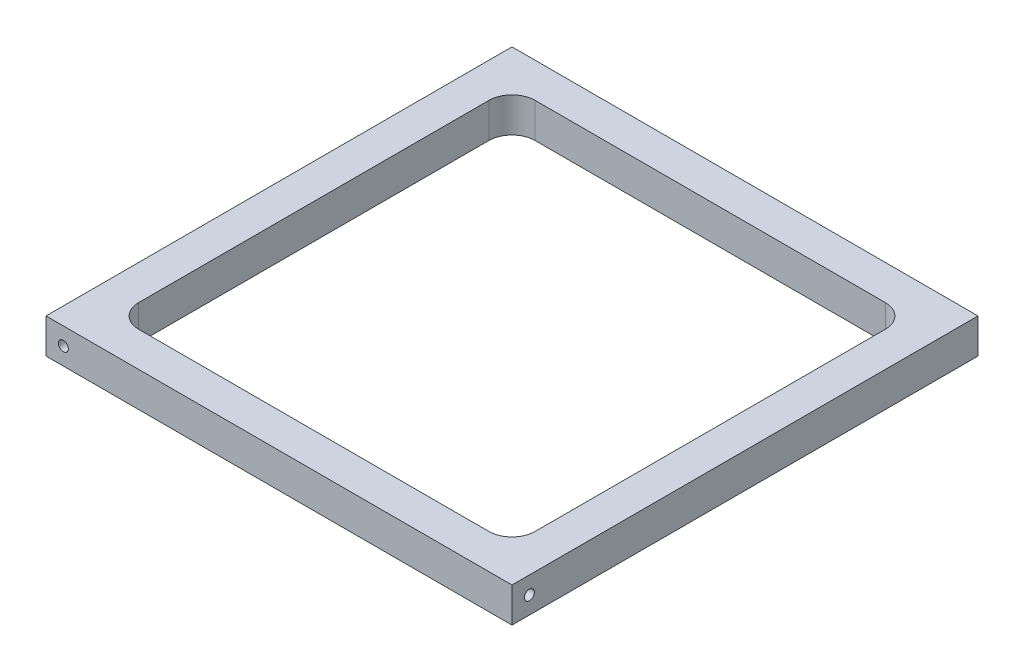
from build123d import *

# Parameters (mm, degrees)
SKETCH1_W           = 127.635
SKETCH1_H           = 127.635
BOSS_EXTRUDE1_DEPTH = 9.525
SKETCH5_W           = 108.585
SKETCH5_H           = 108.585
CUT_EXTRUDE1_DEPTH  = 9.525
FILLET1_R           = 6.35
SKETCH6_R           = 1.3589
TAPPED_HOLE_DEPTH   = 6.35
SKETCH7_R           = 1.35255
CUT_EXTRUDE3_DEPTH  = 6.35
SKETCH8_R           = 1.35255
CUT_EXTRUDE4_DEPTH  = 6.35
SKETCH9_R           = 1.35255
CUT_EXTRUDE5_DEPTH  = 6.35


with BuildPart() as part:
    # Sketch1 → Boss-Extrude1 (new body)
    with BuildSketch(Plane(origin=(0, 0, 0), x_dir=(1, 0, 0), z_dir=(0, 1, 0))):
        with Locations((63.8175, 63.8175)):
            Rectangle(SKETCH1_W, SKETCH1_H)
    extrude(amount=BOSS_EXTRUDE1_DEPTH)

    # Sketch5 → Cut-Extrude1 (cut)
    with BuildSketch(Plane(origin=(0, 9.525, 0), x_dir=(1, 0, 0), z_dir=(0, 1, 0))):
        with Locations((63.8175, 63.8175)):
            Rectangle(SKETCH5_W, SKETCH5_H)
    extrude(amount=-CUT_EXTRUDE1_DEPTH, mode=Mode.SUBTRACT)

    # Fillet1
    fillet1_edges = [part.edges().sort_by_distance(p)[0] for p in [
        (118.11, 4.7625, -9.525),
        (118.11, 4.7625, -118.11),
        (9.525, 4.7625, -118.11),
        (9.525, 4.7625, -9.525),
    ]]
    fillet(fillet1_edges, radius=FILLET1_R)

    # Sketch6 → tapped hole (cut)
    with BuildSketch(Plane(origin=(127.635, 0, 0), x_dir=(0, 0, -1), z_dir=(1, 0, 0))):
        with Locations((4.7625, 4.7625)):
            Circle(SKETCH6_R)
    extrude(amount=-TAPPED_HOLE_DEPTH, mode=Mode.SUBTRACT)

    # Sketch7 → Cut-Extrude3 (cut)
    with BuildSketch(Plane(origin=(0, 0, -127.635), x_dir=(-1, 0, 0), z_dir=(0, 0, -1))):
        with Locations((-122.8725, 4.7625)):
            Circle(SKETCH7_R)
    extrude(amount=-CUT_EXTRUDE3_DEPTH, mode=Mode.SUBTRACT)

    # Sketch8 → Cut-Extrude4 (cut)
    with BuildSketch(Plane.ZY):
        with Locations((-122.8725, 4.7625)):
            Circle(SKETCH8_R)
    extrude(amount=-CUT_EXTRUDE4_DEPTH, mode=Mode.SUBTRACT)

    # Sketch9 → Cut-Extrude5 (cut)
    with BuildSketch(Plane.XY):
        with Locations((4.7625, 4.7625)):
            Circle(SKETCH9_R)
    extrude(amount=-CUT_EXTRUDE5_DEPTH, mode=Mode.SUBTRACT)


solid = part.part
